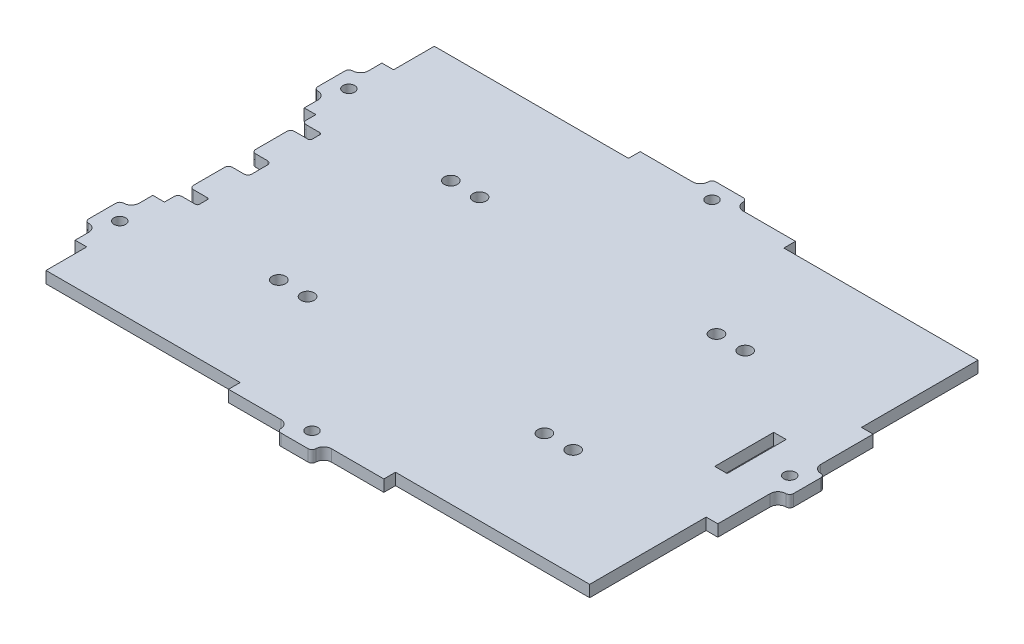
from build123d import *

# Parameters (mm, degrees)
ESBO_O1_W                = 140
ESBO_O1_H                = 100
RESSALTO_EXTRUS_O1_DEPTH = 1.5
RESSALTO_EXTRUS_O2_DEPTH = 3
ESBO_O2_R                = 1.5
CORTE_EXTRUS_O1_DEPTH    = 95.451045521
CUT_EXTRUDE1_DEPTH       = 95.451045521
CUT_EXTRUDE1_DEPTH_BACK  = 95.451045521
SKETCH1_R                = 1.7
CUT_EXTRUDE4_DEPTH       = 95.415305963
CUT_EXTRUDE4_DEPTH_BACK  = 95.415305963
FILLET1_R                = 1
CUT_EXTRUDE3_DEPTH       = 95.415305963
CUT_EXTRUDE3_DEPTH_BACK  = 95.415305963
SKETCH2_W                = 3.2
SKETCH2_H                = 15.2


with BuildPart() as part:
    # Esboço1 → Ressalto-extrusão1 (new, symmetric)
    with BuildSketch(Plane(origin=(0, 0, 0), x_dir=(1, 0, 0), z_dir=(0, 1, 0))):
        Rectangle(ESBO_O1_W, ESBO_O1_H)
    extrude(amount=RESSALTO_EXTRUS_O1_DEPTH, both=True)

    # Esboço4 → Ressalto-extrusão2 (add, through all)
    with BuildSketch(Plane(origin=(0, 1.5, 0), x_dir=(1, 0, 0), z_dir=(0, 1, 0))):
        with BuildLine():
            Line((6.5, 53), (20, 53))
            Line((20, 53), (20, 50))
            Line((20, 50), (-20, 50))
            Line((-20, 50), (-20, 53))
            Line((-20, 53), (-6.5, 53))
            ThreePointArc((-6.5, 53), (-5.085786438, 53.585786438), (-4.5, 55))
            Line((-4.5, 55), (-4.5, 56))
            Line((-4.5, 56), (4.5, 56))
            Line((4.5, 56), (4.5, 55))
            ThreePointArc((4.5, 55), (5.085786438, 53.585786438), (6.5, 53))
        make_face()
        with BuildLine():
            Line((4.5, -56), (4.5, -55))
            ThreePointArc((4.5, -55), (5.085786438, -53.585786438), (6.5, -53))
            Line((6.5, -53), (20, -53))
            Line((20, -53), (20, -50))
            Line((20, -50), (-20, -50))
            Line((-20, -50), (-20, -53))
            Line((-20, -53), (-6.5, -53))
            ThreePointArc((-6.5, -53), (-5.085786438, -53.585786438), (-4.5, -55))
            Line((-4.5, -55), (-4.5, -56))
            Line((-4.5, -56), (4.5, -56))
        make_face()
        with BuildLine():
            Line((70, 20), (73, 20))
            Line((73, 20), (73, 6.5))
            ThreePointArc((73, 6.5), (73.585786438, 5.085786438), (75, 4.5))
            Line((75, 4.5), (76, 4.5))
            Line((76, 4.5), (76, -4.5))
            Line((76, -4.5), (75, -4.5))
            ThreePointArc((75, -4.5), (73.585786438, -5.085786438), (73, -6.5))
            Line((73, -6.5), (73, -20))
            Line((73, -20), (70, -20))
            Line((70, -20), (70, 20))
        make_face()
        with BuildLine():
            Line((-70, 39.5), (-73, 39.5))
            Line((-73, 39.5), (-73, 36))
            ThreePointArc((-73, 36), (-73.585786438, 34.585786438), (-75, 34))
            Line((-75, 34), (-76, 34))
            Line((-76, 34), (-76, 25))
            Line((-76, 25), (-75, 25))
            ThreePointArc((-75, 25), (-73.585786438, 24.414213562), (-73, 23))
            Line((-73, 23), (-73, 19.5))
            Line((-73, 19.5), (-70, 19.5))
            Line((-70, 19.5), (-70, 39.5))
        make_face()
        with BuildLine():
            Line((-76, -34), (-76, -25))
            Line((-76, -25), (-75, -25))
            ThreePointArc((-75, -25), (-73.585786438, -24.414213562), (-73, -23))
            Line((-73, -23), (-73, -19.5))
            Line((-73, -19.5), (-70, -19.5))
            Line((-70, -19.5), (-70, -39.5))
            Line((-70, -39.5), (-73, -39.5))
            Line((-73, -39.5), (-73, -36))
            ThreePointArc((-73, -36), (-73.585786438, -34.585786438), (-75, -34))
            Line((-75, -34), (-76, -34))
        make_face()
    extrude(amount=-RESSALTO_EXTRUS_O2_DEPTH)

    # Esboço2 → Corte-extrusão1 (cut, through all)
    with BuildSketch(Plane(origin=(0, 1.5, 0), x_dir=(1, 0, 0), z_dir=(0, 1, 0))):
        with Locations(Location((0, -51.5, 0), (0, 0, 270))):
            Circle(ESBO_O2_R)
        with Locations(Location((0, 51.5, 0), (0, 0, 90))):
            Circle(ESBO_O2_R)
        with Locations(Location((71.5, 0, 0), (0, 0, 90))):
            Circle(ESBO_O2_R)
        with Locations(Location((-71.5, 29.5, 0), (0, 0, 270))):
            Circle(ESBO_O2_R)
        with Locations(Location((-71.5, -29.5, 0), (0, 0, 90))):
            Circle(ESBO_O2_R)
    extrude(amount=-CORTE_EXTRUS_O1_DEPTH, mode=Mode.SUBTRACT)

    # Sketch1 → Cut-Extrude1 (cut, two sides: drawn at the far end of the back side and taken through both)
    with BuildSketch(Plane(origin=(0, 1.5, 0), x_dir=(1, 0, 0), z_dir=(0, 1, 0)).offset(-CUT_EXTRUDE1_DEPTH_BACK)):
        with Locations(Location((30.5, -22.15, 0), (0, 0, 270))):
            Circle(SKETCH1_R)
        with Locations(Location((37.9, -22.15, 0), (0, 0, 270))):
            Circle(SKETCH1_R)
        with Locations(Location((37.9, 22.15, 0), (0, 0, 90))):
            Circle(SKETCH1_R)
        with Locations(Location((30.5, 22.15, 0), (0, 0, 90))):
            Circle(SKETCH1_R)
        with Locations(Location((-30.5, 22.15, 0), (0, 0, 270))):
            Circle(SKETCH1_R)
        with Locations(Location((-37.9, 22.15, 0), (0, 0, 270))):
            Circle(SKETCH1_R)
        with Locations(Location((-37.9, -22.15, 0), (0, 0, 90))):
            Circle(SKETCH1_R)
        with Locations(Location((-30.5, -22.15, 0), (0, 0, 90))):
            Circle(SKETCH1_R)
    extrude(amount=CUT_EXTRUDE1_DEPTH + CUT_EXTRUDE1_DEPTH_BACK, mode=Mode.SUBTRACT)

    # Sketch3 → Cut-Extrude4 (cut, two sides: drawn at the far end of the back side and taken through both)
    with BuildSketch(Plane(origin=(0, 0, 0), x_dir=(1, 0, 0), z_dir=(0, 1, 0)).offset(-CUT_EXTRUDE4_DEPTH_BACK)):
        with BuildLine():
            Line((-70, 3), (-66, 3))
            ThreePointArc((-66, 3), (-65.292893219, 2.707106781), (-65, 2))
            Line((-65, 2), (-65, -2))
            ThreePointArc((-65, -2), (-65.292893219, -2.707106781), (-66, -3))
            Line((-66, -3), (-70, -3))
            Line((-70, -3), (-70, 3))
        make_face()
        with BuildLine():
            Line((-70, 16), (-65.5, 16))
            ThreePointArc((-65.5, 16), (-65.146446609, 15.853553391), (-65, 15.5))
            Line((-65, 15.5), (-65, 13.5))
            ThreePointArc((-65, 13.5), (-65.146446609, 13.146446609), (-65.5, 13))
            Line((-65.5, 13), (-70, 13))
            Line((-70, 13), (-70, 16))
        make_face()
        with BuildLine():
            Line((-65, -15.5), (-65, -13.5))
            ThreePointArc((-65, -13.5), (-65.146446609, -13.146446609), (-65.5, -13))
            Line((-65.5, -13), (-70, -13))
            Line((-70, -13), (-70, -16))
            Line((-70, -16), (-65.5, -16))
            ThreePointArc((-65.5, -16), (-65.146446609, -15.853553391), (-65, -15.5))
        make_face()
    extrude(amount=CUT_EXTRUDE4_DEPTH + CUT_EXTRUDE4_DEPTH_BACK, mode=Mode.SUBTRACT)

    # Fillet1
    fillet1_edges = [part.edges().sort_by_distance(p)[0] for p in [
        (-4.5, 0, -56),
        (4.5, 0, -56),
        (4.5, 0, 56),
        (-4.5, 0, 56),
        (76, 0, 4.5),
        (76, 0, -4.5),
        (-76, 0, 25),
        (-76, 0, 34),
        (-76, 0, -25),
        (-76, 0, -34),
        (-70, 0, 3),
        (-70, 0, -3),
        (-70, 0, -16),
        (-70, 0, -13),
        (-70, 0, 16),
        (-70, 0, 13),
    ]]
    fillet(fillet1_edges, radius=FILLET1_R - 0.0001)  # a hair under: the kernel refuses the full size

    # Sketch2 → Cut-Extrude3 (cut, two sides: drawn at the far end of the back side and taken through both)
    with BuildSketch(Plane(origin=(0, 0, 0), x_dir=(1, 0, 0), z_dir=(0, 1, 0)).offset(-CUT_EXTRUDE3_DEPTH_BACK)):
        with Locations((61.4, 0)):
            Rectangle(SKETCH2_W, SKETCH2_H)
    extrude(amount=CUT_EXTRUDE3_DEPTH + CUT_EXTRUDE3_DEPTH_BACK, mode=Mode.SUBTRACT)


solid = part.part
